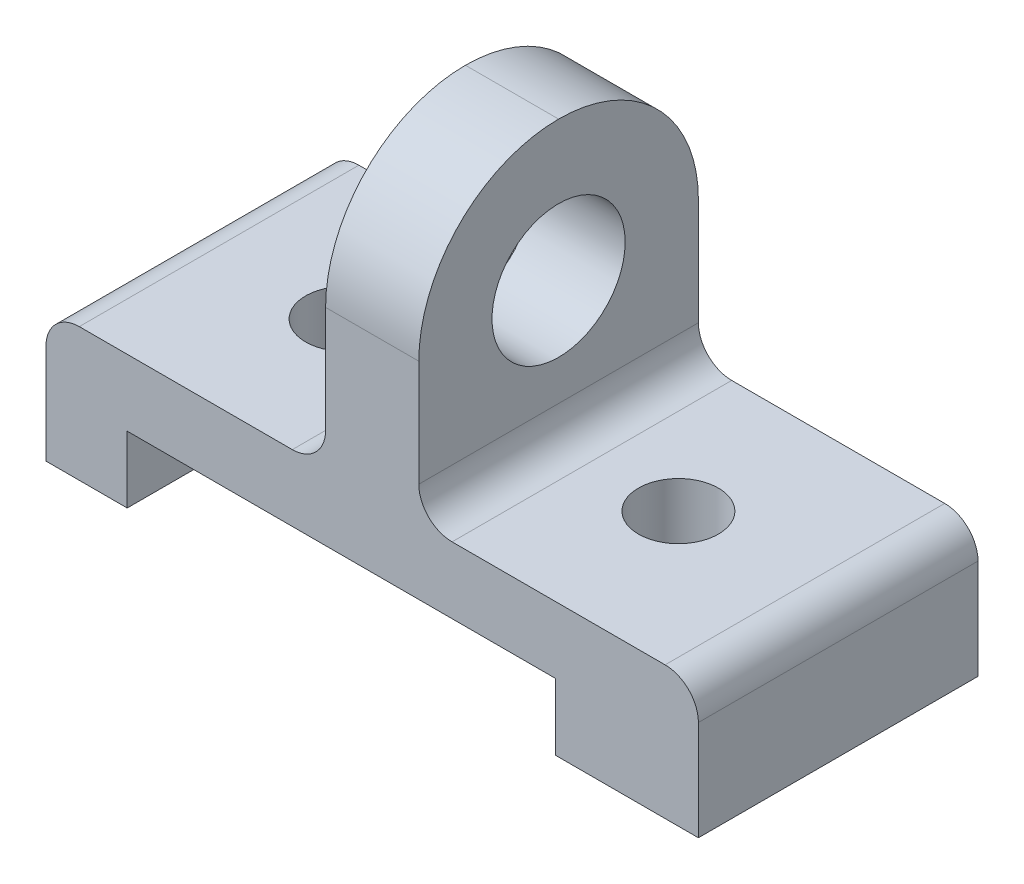
from build123d import *

# Parameters (mm, degrees)
SKETCH2_W           = 98
SKETCH2_H           = 42
BOSS_EXTRUDE1_DEPTH = 10
SKETCH3_W           = 64.32909673
SKETCH3_H           = 10
CUT_EXTRUDE3_DEPTH  = 108.088748242
SKETCH4_W           = 42
SKETCH4_H           = 42
BOSS_EXTRUDE2_DEPTH = 7
FILLET1_R           = 21
SKETCH5_R           = 10
CUT_EXTRUDE4_DEPTH  = 14
SKETCH7_R           = 6
CUT_EXTRUDE6_DEPTH  = 115.594938806
FILLET5_R           = 5
FILLET6_R           = 5
FILLET7_R           = 5


with BuildPart() as part:
    # Sketch2 → Boss-Extrude1 (new, symmetric)
    with BuildSketch(Plane(origin=(0, 0, 0), x_dir=(1, 0, 0), z_dir=(0, 1, 0))):
        with Locations((49, 21)):
            Rectangle(SKETCH2_W, SKETCH2_H)
    extrude(amount=BOSS_EXTRUDE1_DEPTH, both=True)

    # Sketch3 → Cut-Extrude3 (cut, through all)
    with BuildSketch(Plane.XY):
        with Locations((44.363668704, -5)):
            Rectangle(SKETCH3_W, SKETCH3_H)
    extrude(amount=-CUT_EXTRUDE3_DEPTH, mode=Mode.SUBTRACT)

    # Sketch4 → Boss-Extrude2 (add, symmetric)
    with BuildSketch(Plane(origin=(49, 0, 0), x_dir=(0, 0, -1), z_dir=(1, 0, 0))):
        with Locations((21, 31)):
            Rectangle(SKETCH4_W, SKETCH4_H)
    extrude(amount=BOSS_EXTRUDE2_DEPTH, both=True)

    # Fillet1
    fillet1_edges = [part.edges().sort_by_distance(p)[0] for p in [
        (49, 52, 0),
        (49, 52, -42),
    ]]
    fillet(fillet1_edges, radius=FILLET1_R - 0.0001)  # a hair under: the kernel refuses the full size

    # Sketch5 → Cut-Extrude4 (cut)
    with BuildSketch(Plane(origin=(56, 0, 0), x_dir=(0, 0, -1), z_dir=(1, 0, 0))):
        with Locations((21, 31)):
            Circle(SKETCH5_R)
    extrude(amount=-CUT_EXTRUDE4_DEPTH, mode=Mode.SUBTRACT)

    # Sketch7 → Cut-Extrude6 (cut, through all)
    with BuildSketch(Plane(origin=(0, 10, 0), x_dir=(1, 0, 0), z_dir=(0, 1, 0))):
        with Locations(Location((24, 21, 0), (0, 0, 270))):
            Circle(SKETCH7_R)
    cut_extrude6 = extrude(amount=-CUT_EXTRUDE6_DEPTH, mode=Mode.SUBTRACT)

    # Mirror3: Cut-Extrude6 across plane
    add(cut_extrude6.mirror(Plane(origin=(49, 0, 0), x_dir=(0, 0, 1), z_dir=(1, 0, 0))), mode=Mode.SUBTRACT)

    # Fillet5
    fillet5_edges = [part.edges().sort_by_distance(p)[0] for p in [
        (98, 10, -21),
    ]]
    fillet(fillet5_edges, radius=FILLET5_R)

    # Fillet6
    fillet6_edges = [part.edges().sort_by_distance(p)[0] for p in [
        (0, 10, -21),
    ]]
    fillet(fillet6_edges, radius=FILLET6_R)

    # Fillet7
    fillet7_edges = [part.edges().sort_by_distance(p)[0] for p in [
        (42, 10, -21),
        (56, 10, -21),
    ]]
    fillet(fillet7_edges, radius=FILLET7_R)


solid = part.part
